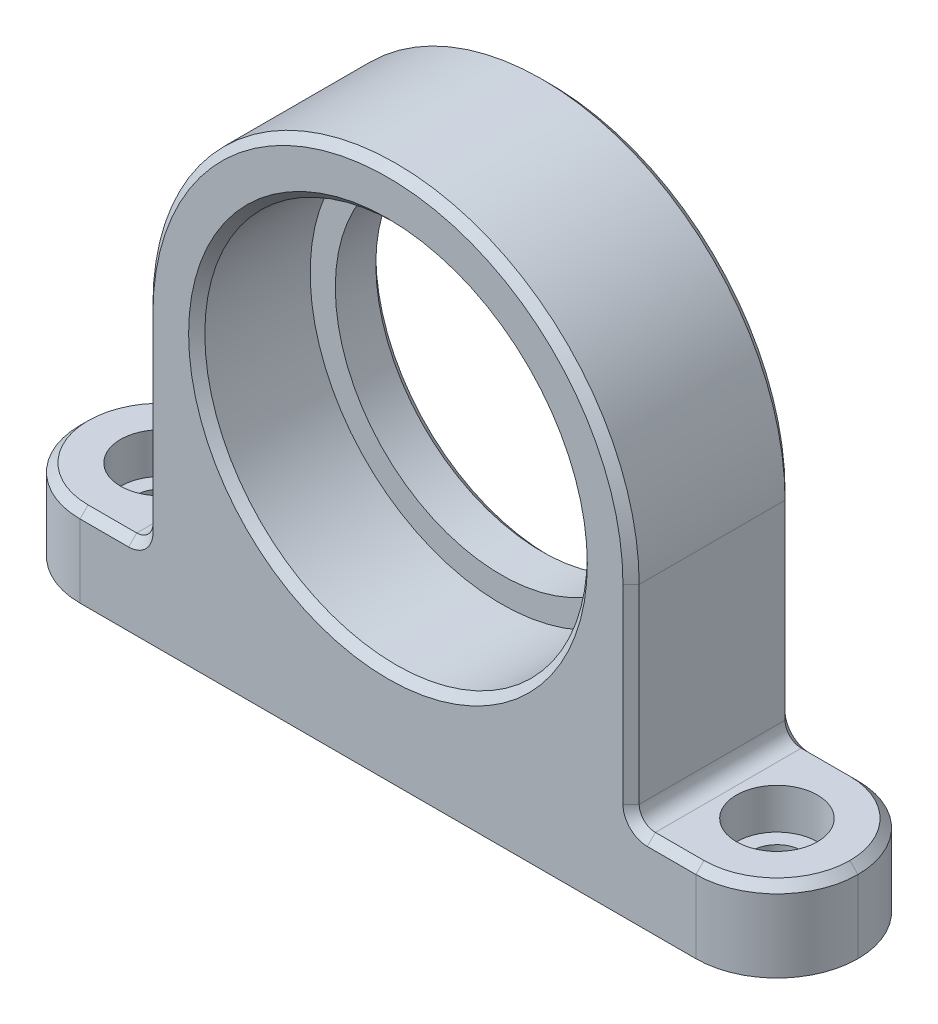
from build123d import *

# Parameters (mm, degrees)
SKETCH_1_W          = 96
SKETCH_1_H          = 20
EXTRUDE_1_DEPTH     = 10
SKETCH_2_R          = 5
CUT_EXTRUDE_1_DEPTH = 5
FILLET_1_R          = 10
SKETCH_3_R          = 3.1
CUT_EXTRUDE_2_DEPTH = 5
CHAMFER_1_SIZE      = 1
SKETCH_4_W          = 60
SKETCH_4_H          = 20
EXTRUDE_2_DEPTH     = 55.5
CUT_EXTRUDE_START   = -20
CUT_EXTRUDE_3_DEPTH = 20
SKETCH_6_4_R        = 23.6
CUT_EXTRUDE_4_DEPTH = 14
SKETCH_7_R          = 20.5
CUT_EXTRUDE_5_DEPTH = 10
FILLET_2_R          = 2
CHAMFER_2_SIZE      = 1
CHAMFER_3_SIZE      = 1


# Read off the part's stored shape, not the designer's step: 切除-拉伸3
with BuildPart() as part:
    # 草图1 → 凸台-拉伸1 (new body)
    with BuildSketch(Plane(origin=(0, 0, 0), x_dir=(1, 0, 0), z_dir=(0, 1, 0))):
        Rectangle(SKETCH_1_W, SKETCH_1_H)
    extrude(amount=EXTRUDE_1_DEPTH)

    # 草图2 → 切除-拉伸1 (cut)
    with BuildSketch(Plane(origin=(0, 10, 0), x_dir=(1, 0, 0), z_dir=(0, 1, 0))):
        with Locations(Location((-38, 0, 0), (0, 0, 270))):
            Circle(SKETCH_2_R)
        with Locations(Location((38, 0, 0), (0, 0, 90))):
            Circle(SKETCH_2_R)
    extrude(amount=-CUT_EXTRUDE_1_DEPTH, mode=Mode.SUBTRACT)

    # 圆角1
    fillet_1_edges = [part.edges().sort_by_distance(p)[0] for p in [
        (48, 5, -10),
        (48, 5, 10),
        (-48, 5, 10),
        (-48, 5, -10),
    ]]
    fillet(fillet_1_edges, radius=FILLET_1_R - 0.0001)  # a hair under: the kernel refuses the full size

    # 草图3 → 切除-拉伸2 (cut)
    with BuildSketch(Plane(origin=(0, 5, 0), x_dir=(1, 0, 0), z_dir=(0, 1, 0))):
        with Locations(Location((-38, 0, 0), (0, 0, 270))):
            Circle(SKETCH_3_R)
        with Locations(Location((38, 0, 0), (0, 0, 270))):
            Circle(SKETCH_3_R)
    extrude(amount=-CUT_EXTRUDE_2_DEPTH, mode=Mode.SUBTRACT)

    # 倒角1
    chamfer_1_edges = [part.edges().sort_by_distance(p)[0] for p in [
        (-38, 0, -3.1),
        (38, 0, -3.1),
    ]]
    chamfer(chamfer_1_edges, length=CHAMFER_1_SIZE)

    # 草图4 → 凸台-拉伸2 (add)
    with BuildSketch(Plane(origin=(0, 10, 0), x_dir=(1, 0, 0), z_dir=(0, 1, 0))):
        Rectangle(SKETCH_4_W, SKETCH_4_H)
    extrude(amount=EXTRUDE_2_DEPTH)

    # 切除-拉伸3 outline → 切除-拉伸3 (cut)
    with BuildSketch(Plane.XY.offset(10).offset(CUT_EXTRUDE_START)):
        with BuildLine():
            Line((-30, 65.5), (-30, 35.5))
            ThreePointArc((-30, 35.5), (-21.213203436, 56.713203436), (0, 65.5))
            Line((0, 65.5), (-30, 65.5))
        make_face()
        with BuildLine():
            Line((30, 65.5), (0, 65.5))
            ThreePointArc((0, 65.5), (21.213203436, 56.713203436), (30, 35.5))
            Line((30, 35.5), (30, 65.5))
        make_face()
    extrude(amount=CUT_EXTRUDE_3_DEPTH, mode=Mode.SUBTRACT)

    # 草图6<4> → 切除-拉伸4 (cut)
    with BuildSketch(Plane.XY.offset(10)):
        with Locations((0, 35.5)):
            Circle(SKETCH_6_4_R)
    extrude(amount=-CUT_EXTRUDE_4_DEPTH, mode=Mode.SUBTRACT)

    # 草图7 → 切除-拉伸5 (cut)
    with BuildSketch(Plane.XY.offset(-4)):
        with Locations((0, 35.5)):
            Circle(SKETCH_7_R)
    extrude(amount=-CUT_EXTRUDE_5_DEPTH, mode=Mode.SUBTRACT)

    # 圆角2
    fillet_2_edges = [part.edges().sort_by_distance(p)[0] for p in [
        (30, 10, 0),
        (-30, 10, 0),
    ]]
    fillet(fillet_2_edges, radius=FILLET_2_R)

    # 倒角2
    chamfer_2_edges = [part.edges().sort_by_distance(p)[0] for p in [
        (35.00005, 10, 10),
        (35.00005, 10, -10),
        (30.585786438, 10.585786438, -10),
        (30.585786438, 10.585786438, 10),
        (-30.585786438, 10.585786438, 10),
        (-30.585786438, 10.585786438, -10),
        (-35.00005, 10, -10),
        (-35.00005, 10, 10),
        (-45.071097101, 10, -7.071097101),
        (-45.071097101, 10, 7.071097101),
        (45.071097101, 10, 7.071097101),
        (45.071097101, 10, -7.071097101),
        (-30, 23.75, 10),
        (-30, 23.75, -10),
        (30, 23.75, -10),
        (30, 23.75, 10),
        (21.213203436, 56.713203436, -10),
        (-21.213203436, 56.713203436, 10),
    ]]
    chamfer(chamfer_2_edges, length=CHAMFER_2_SIZE)

    # 倒角3
    chamfer_3_edges = [part.edges().sort_by_distance(p)[0] for p in [
        (-20.5, 35.5, -10),
        (-23.6, 35.5, 10),
    ]]
    chamfer(chamfer_3_edges, length=CHAMFER_3_SIZE)


solid = part.part
